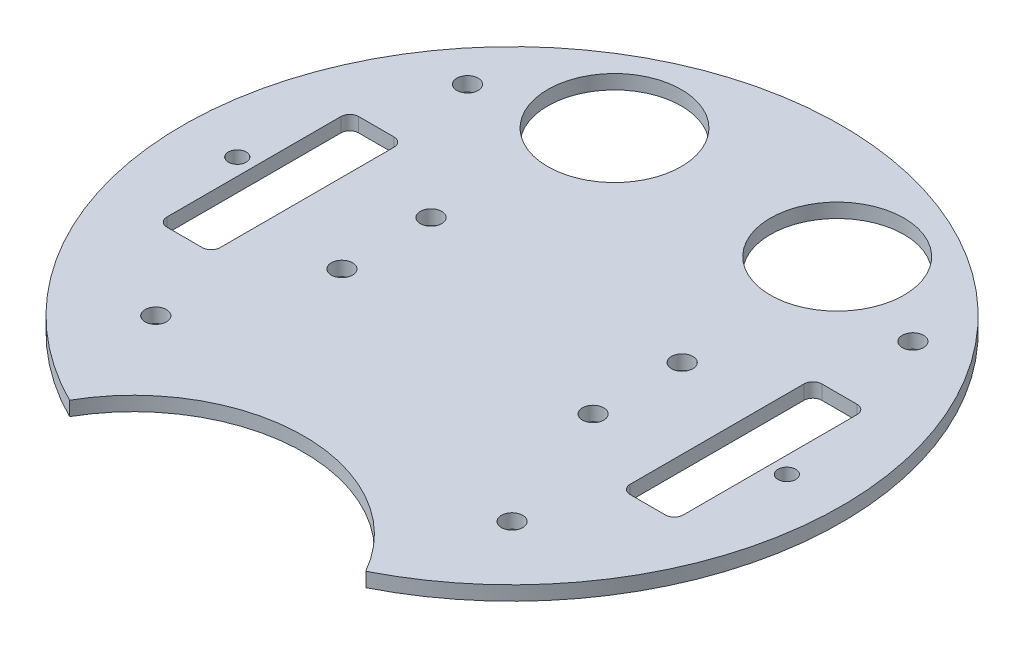
from build123d import *

# Parameters (mm, degrees)
BOSS_EXTRUDE1_DEPTH = 3.2
SKETCH2_W           = 10.76
SKETCH2_H           = 41.868700306
CUT_EXTRUDE1_DEPTH  = 105.70071633
SKETCH3_R           = 2
SKETCH3_R_2         = 2.4
CUT_EXTRUDE2_DEPTH  = 105.70071633
SKETCH4_R           = 15
CUT_EXTRUDE3_DEPTH  = 105.70071633
CUT_EXTRUDE4_DEPTH  = 105.70071633
SKETCH6_R           = 2.4
CUT_EXTRUDE5_DEPTH  = 105.70071633


with BuildPart() as part:
    # Sketch1 → Boss-Extrude1 (new body)
    with BuildSketch(Plane(origin=(0, 0, 0), x_dir=(1, 0, 0), z_dir=(0, 1, 0))):
        with BuildLine():
            ThreePointArc((33.257494275, -66.105514706), (0, 74), (-33.257494275, -66.105514706))
            ThreePointArc((-33.257494275, -66.105514706), (0, -46.75), (33.257494275, -66.105514706))
        make_face()
    extrude(amount=BOSS_EXTRUDE1_DEPTH)

    # Sketch2 → Cut-Extrude1 (cut, through all)
    with BuildSketch(Plane(origin=(0, 3.2, 0), x_dir=(1, 0, 0), z_dir=(0, 1, 0))):
        with Locations((-51.99, 0)):
            Rectangle(SKETCH2_W, SKETCH2_H)
        with Locations((51.99, 0)):
            Rectangle(SKETCH2_W, SKETCH2_H)
    extrude(amount=-CUT_EXTRUDE1_DEPTH, mode=Mode.SUBTRACT)

    # Sketch3 → Cut-Extrude2 (cut, through all)
    with BuildSketch(Plane.XZ):
        with Locations((-61.7, 0)):
            Circle(SKETCH3_R)
        with Locations((-28.2, 10)):
            Circle(SKETCH3_R_2)
        with Locations((-28.2, -10)):
            Circle(SKETCH3_R_2)
        with Locations((28.2, -10)):
            Circle(SKETCH3_R_2)
        with Locations((28.2, 10)):
            Circle(SKETCH3_R_2)
        with Locations((61.7, 0)):
            Circle(SKETCH3_R)
    extrude(amount=-CUT_EXTRUDE2_DEPTH, mode=Mode.SUBTRACT)

    # Sketch4 → Cut-Extrude3 (cut, through all)
    with BuildSketch(Plane(origin=(0, 3.2, 0), x_dir=(1, 0, 0), z_dir=(0, 1, 0))):
        with Locations((-25, 48)):
            Circle(SKETCH4_R)
        with Locations((25, 48)):
            Circle(SKETCH4_R)
    extrude(amount=-CUT_EXTRUDE3_DEPTH, mode=Mode.SUBTRACT)

    # Sketch5 → Cut-Extrude4 (cut, through all)
    with BuildSketch(Plane(origin=(0, 3.2, 0), x_dir=(1, 0, 0), z_dir=(0, 1, 0))):
        with BuildLine():
            Line((-55.955786438, 21.520136591), (-48.024213562, 21.520136591))
            ThreePointArc((-48.024213562, 21.520136591), (-46.61, 20.934350153), (-46.024213562, 19.520136591))
            Line((-46.024213562, 19.520136591), (-46.024213562, -19.520136591))
            ThreePointArc((-46.024213562, -19.520136591), (-46.61, -20.934350153), (-48.024213562, -21.520136591))
            Line((-48.024213562, -21.520136591), (-55.955786438, -21.520136591))
            ThreePointArc((-55.955786438, -21.520136591), (-57.37, -20.934350153), (-57.955786438, -19.520136591))
            Line((-57.955786438, -19.520136591), (-57.955786438, 19.520136591))
            ThreePointArc((-57.955786438, 19.520136591), (-57.37, 20.934350153), (-55.955786438, 21.520136591))
        make_face()
        with BuildLine():
            Line((46.024213562, 19.520136591), (46.024213562, -19.520136591))
            ThreePointArc((46.024213562, -19.520136591), (46.61, -20.934350153), (48.024213562, -21.520136591))
            Line((48.024213562, -21.520136591), (55.955786438, -21.520136591))
            ThreePointArc((55.955786438, -21.520136591), (57.37, -20.934350153), (57.955786438, -19.520136591))
            Line((57.955786438, -19.520136591), (57.955786438, 19.520136591))
            ThreePointArc((57.955786438, 19.520136591), (57.37, 20.934350153), (55.955786438, 21.520136591))
            Line((55.955786438, 21.520136591), (48.024213562, 21.520136591))
            ThreePointArc((48.024213562, 21.520136591), (46.61, 20.934350153), (46.024213562, 19.520136591))
        make_face()
    extrude(amount=-CUT_EXTRUDE4_DEPTH, mode=Mode.SUBTRACT)

    # Sketch6 → Cut-Extrude5 (cut, through all)
    with BuildSketch(Plane(origin=(0, 3.2, 0), x_dir=(1, 0, 0), z_dir=(0, 1, 0))):
        with Locations((-50, 40)):
            Circle(SKETCH6_R)
        with Locations((-40, -40)):
            Circle(SKETCH6_R)
        with Locations((40, -40)):
            Circle(SKETCH6_R)
        with Locations((50, 40)):
            Circle(SKETCH6_R)
    extrude(amount=-CUT_EXTRUDE5_DEPTH, mode=Mode.SUBTRACT)


solid = part.part
